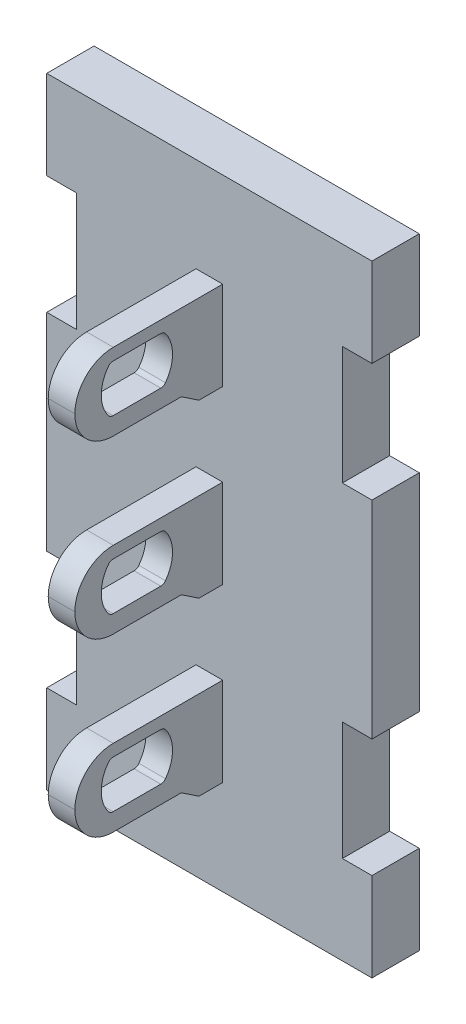
from build123d import *
from OCP.BRepFilletAPI import BRepFilletAPI_MakeChamfer

# Parameters (mm, degrees)
SKETCH_1_W                     = 5.5
SKETCH_1_H                     = 10.5
EXTRUDE_1_DEPTH                = 0.8
SKETCH_2_W                     = 1
SKETCH_2_H                     = 2
CUT_EXTRUDE_1_DEPTH            = 6.980384603
SKETCH_3_W                     = 0.45
SKETCH_3_H                     = 1.5
EXTRUDE_2_DEPTH                = 2.5
SKETCH_5_W                     = 1.8
SKETCH_5_H                     = 0.2
CUT_EXTRUDE_2_DEPTH            = 7.877726732
FILLET_5_R                     = 0.65
CHAMFER_1_SIZE                 = 0.3
CHAMFER_1_SIZE_2               = 0.2
CUT_EXTRUDE_3_DEPTH            = 7.877726732
FILLET_6_R                     = 0.1
PATTERN_LINEAR_1_COUNT         = 3
PATTERN_LINEAR_1_PITCH         = 2.9
FILLET_6_OF_PATTERN_LINEAR_1_R = 0.1
SKETCH_3_2_W                   = 0.45
SKETCH_3_2_H                   = 1.5
EXTRUDE_3_DEPTH                = 1.4
SKETCH_8_W                     = 0.5
SKETCH_8_H                     = 2.5
EXTRUDE_4_DEPTH                = 0.45


with BuildPart() as part:
    # 草图1 → 凸台-拉伸1 (new body)
    with BuildSketch(Plane.XY):
        Rectangle(SKETCH_1_W, SKETCH_1_H)
    extrude(amount=EXTRUDE_1_DEPTH)

    # 草图2 → 切除-拉伸1 (cut, through all)
    with BuildSketch(Plane(origin=(0, 0, 0), x_dir=(-1, 0, 0), z_dir=(0, 0, -1))):
        with Locations((-2.75, 2.75)):
            Rectangle(SKETCH_2_W, SKETCH_2_H)
        with Locations((-2.75, -2.75)):
            Rectangle(SKETCH_2_W, SKETCH_2_H)
        with Locations((2.75, -2.75)):
            Rectangle(SKETCH_2_W, SKETCH_2_H)
        with Locations((2.75, 2.75)):
            Rectangle(SKETCH_2_W, SKETCH_2_H)
    extrude(amount=-CUT_EXTRUDE_1_DEPTH, mode=Mode.SUBTRACT)

    # 草图3 → 凸台-拉伸2 (add)
    with BuildSketch(Plane.XY.offset(0.8)):
        with Locations((0, 2.9)):
            Rectangle(SKETCH_3_W, SKETCH_3_H)
        Rectangle(SKETCH_3_W, SKETCH_3_H)
        with Locations((0, -2.9)):
            Rectangle(SKETCH_3_W, SKETCH_3_H)
    extrude(amount=EXTRUDE_2_DEPTH)

    # 草图5 → 切除-拉伸2 (cut, through all)
    with BuildSketch(Plane.ZY.offset(0.225)):
        with Locations((2.4, 2.25)):
            Rectangle(SKETCH_5_W, SKETCH_5_H)
        with Locations((2.4, -0.65)):
            Rectangle(SKETCH_5_W, SKETCH_5_H)
        with Locations((2.4, -3.55)):
            Rectangle(SKETCH_5_W, SKETCH_5_H)
    extrude(amount=-CUT_EXTRUDE_2_DEPTH, mode=Mode.SUBTRACT)

    # 圆角5
    fillet_5_edges = [part.edges().sort_by_distance(p)[0] for p in [
        (0, -3.45, 3.3),
        (0, -2.15, 3.3),
        (0, -0.55, 3.3),
        (0, 0.75, 3.3),
        (0, 2.35, 3.3),
        (0, 3.65, 3.3),
    ]]
    fillet(fillet_5_edges, radius=FILLET_5_R - 0.0001)  # a hair under: the kernel refuses the full size

    # 倒角1
    chamfer_1_edges_1 = [part.edges().sort_by_distance(p)[0] for p in [
        (0, 2.15, 1.5),
    ]]
    chamfer_1_side_1 = [part.faces().sort_by_distance(p)[0] for p in [
        (0, 2.15, 1.496),
    ]]
    chamfer_1_edges_2 = [part.edges().sort_by_distance(p)[0] for p in [
        (0, -0.75, 1.5),
    ]]
    chamfer_1_side_2 = [part.faces().sort_by_distance(p)[0] for p in [
        (0, -0.75, 1.496),
    ]]
    chamfer_1_edges_3 = [part.edges().sort_by_distance(p)[0] for p in [
        (0, -3.65, 1.5),
    ]]
    chamfer_1_side_3 = [part.faces().sort_by_distance(p)[0] for p in [
        (0, -3.65, 1.496),
    ]]
    chamfer_1 = BRepFilletAPI_MakeChamfer(part.part.solid().wrapped)
    for e in chamfer_1_edges_1:
        chamfer_1.Add(CHAMFER_1_SIZE - 0.0001, CHAMFER_1_SIZE_2 - 0.0001, e.wrapped, chamfer_1_side_1[0].wrapped)
    for e in chamfer_1_edges_2:
        chamfer_1.Add(CHAMFER_1_SIZE - 0.0001, CHAMFER_1_SIZE_2 - 0.0001, e.wrapped, chamfer_1_side_2[0].wrapped)
    for e in chamfer_1_edges_3:
        chamfer_1.Add(CHAMFER_1_SIZE - 0.0001, CHAMFER_1_SIZE_2 - 0.0001, e.wrapped, chamfer_1_side_3[0].wrapped)
    add(Compound.cast(chamfer_1.Shape()), mode=Mode.REPLACE)  # a hair under: the kernel refuses the full size

    # 草图6 → 切除-拉伸3 (cut, through all)
    with BuildSketch(Plane.ZY.offset(0.225)):
        with BuildLine():
            Line((2.7, 2.65), (1.8, 2.65))
            ThreePointArc((1.8, 2.65), (1.647213595, 3.05), (1.8, 3.45))
            Line((1.8, 3.45), (2.7, 3.45))
            ThreePointArc((2.7, 3.45), (2.852786405, 3.05), (2.7, 2.65))
        make_face()
    cut_extrude_3 = extrude(amount=-CUT_EXTRUDE_3_DEPTH, mode=Mode.SUBTRACT)

    # 圆角6
    fillet_6_edges = [part.edges().sort_by_distance(p)[0] for p in [
        (0, 2.65, 1.8),
        (0, 3.45, 1.8),
        (0, 3.45, 2.7),
        (0, 2.65, 2.7),
    ]]
    fillet(fillet_6_edges, radius=FILLET_6_R)

    # 阵列(线性)1: 切除-拉伸3 ×3
    with Locations(*[(0, -i * PATTERN_LINEAR_1_PITCH, 0) for i in range(1, PATTERN_LINEAR_1_COUNT)]):
        add(cut_extrude_3, mode=Mode.SUBTRACT)

    # 圆角6 of 阵列(线性)1
    fillet_6_of_pattern_linear_1_edges = [part.edges().sort_by_distance(p)[0] for p in [
        (0, -0.25, 1.8),
        (0, 0.55, 1.8),
        (0, 0.55, 2.7),
        (0, -0.25, 2.7),
        (0, -3.15, 1.8),
        (0, -2.35, 1.8),
        (0, -2.35, 2.7),
        (0, -3.15, 2.7),
    ]]
    fillet(fillet_6_of_pattern_linear_1_edges, radius=FILLET_6_OF_PATTERN_LINEAR_1_R)

    # 草图3<2> → 凸台-拉伸3 (add)
    with BuildSketch(Plane.XY.offset(0.8)):
        with Locations((0, 2.9)):
            Rectangle(SKETCH_3_2_W, SKETCH_3_2_H)
        Rectangle(SKETCH_3_2_W, SKETCH_3_2_H)
        with Locations((0, -2.9)):
            Rectangle(SKETCH_3_2_W, SKETCH_3_2_H)
    extrude(amount=-EXTRUDE_3_DEPTH)

    # 草图8 → 凸台-拉伸4 (add)
    with BuildSketch(Plane.ZY.offset(0.225)):
        with Locations((-0.35, -2.9)):
            Rectangle(SKETCH_8_W, SKETCH_8_H)
        with Locations((-0.35, 2.9)):
            Rectangle(SKETCH_8_W, SKETCH_8_H)
        with BuildLine():
            Line((-0.6, -1.25), (-0.1, -1.25))
            Line((-0.1, -1.25), (-0.1, 1.25))
            Line((-0.1, 1.25), (-0.6, 1.25))
            ThreePointArc((-0.6, 1.25), (-1.0387505, 0), (-0.6, -1.25))
        make_face()
    extrude(amount=-EXTRUDE_4_DEPTH)


solid = part.part
